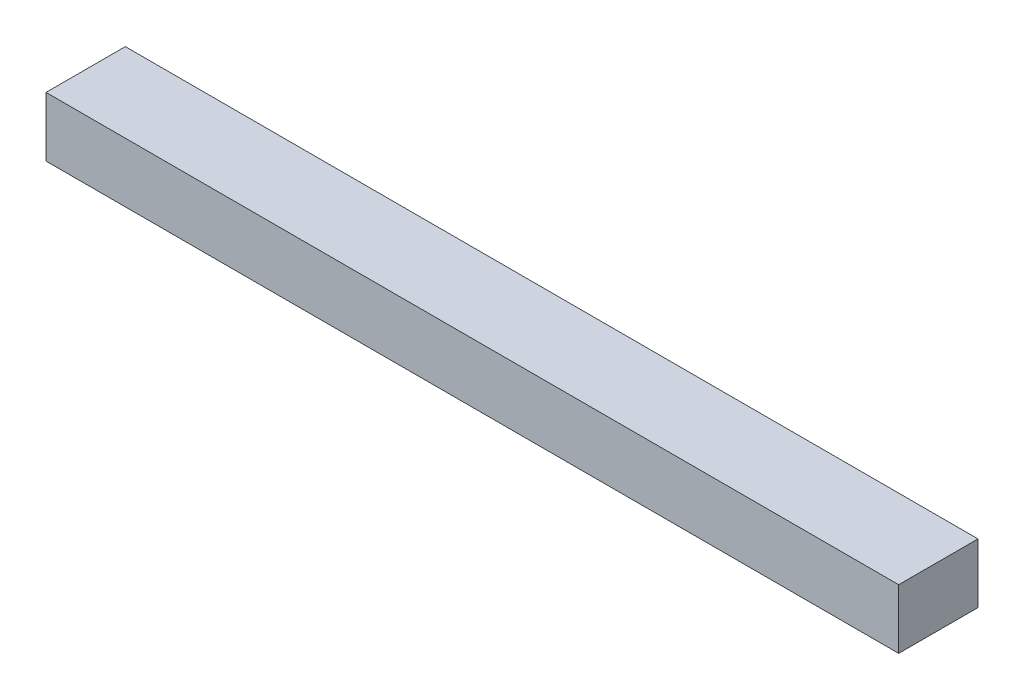
from build123d import *

# Parameters (mm, degrees)
SKETCH1_W           = 86
SKETCH1_H           = 8
BOSS_EXTRUDE1_DEPTH = 6


with BuildPart() as part:
    # Sketch1 → Boss-Extrude1 (new body)
    with BuildSketch(Plane(origin=(0, 0, 0), x_dir=(1, 0, 0), z_dir=(0, 1, 0))):
        with Locations((43, 4)):
            Rectangle(SKETCH1_W, SKETCH1_H)
    extrude(amount=BOSS_EXTRUDE1_DEPTH)


solid = part.part
